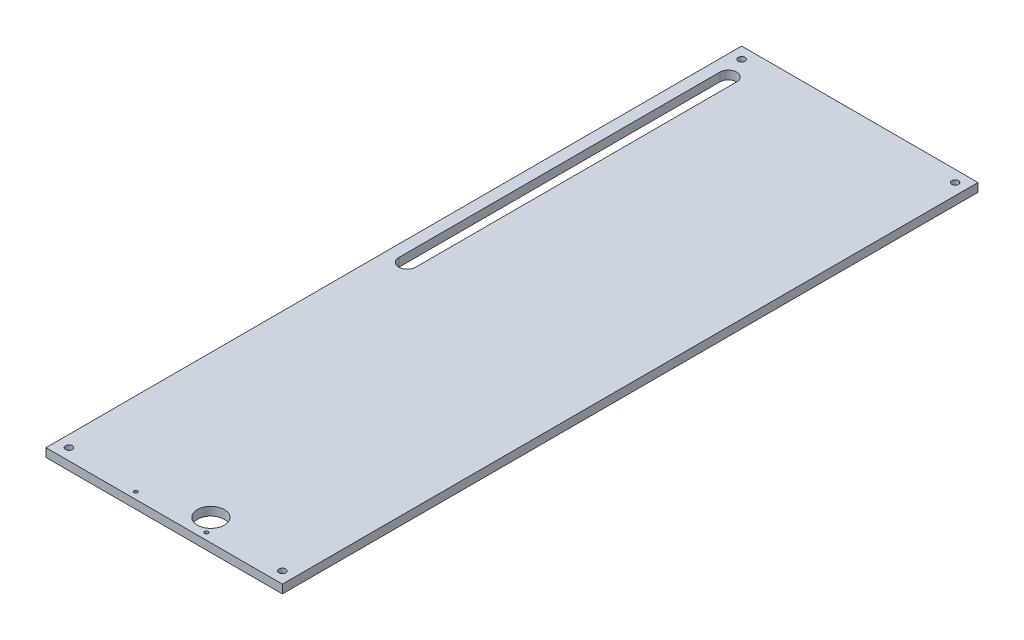
from build123d import *

# Parameters (mm, degrees)
SKETCH2_W           = 88.9
SKETCH2_H           = 3.2004
BOSS_EXTRUDE1_DEPTH = 261.62
SKETCH3_R           = 0.6731
SKETCH3_R_2         = 5.08
SKETCH3_R_3         = 1.27
CUT_EXTRUDE1_DEPTH  = 266.665663227


with BuildPart() as part:
    # Sketch2 → Boss-Extrude1 (new body)
    with BuildSketch(Plane.XY):
        with Locations((-1.625781684, -22.993244248)):
            Rectangle(SKETCH2_W, SKETCH2_H)
    extrude(amount=BOSS_EXTRUDE1_DEPTH)

    # Sketch3 → Cut-Extrude1 (cut, through all)
    with BuildSketch(Plane(origin=(0, -21.393044248, 0), x_dir=(-1, 0, 0), z_dir=(0, 1, 0))):
        with Locations((14.833781684, 259.08)):
            Circle(SKETCH3_R)
        with Locations((-11.683818316, 259.08)):
            Circle(SKETCH3_R)
        with Locations((-7.619818316, 253.318755316)):
            Circle(SKETCH3_R_2)
        with Locations((-38.506218316, 257.302)):
            Circle(SKETCH3_R_3)
        with Locations((41.757781684, 257.302)):
            Circle(SKETCH3_R_3)
        with Locations((-38.506218316, 4.318)):
            Circle(SKETCH3_R_3)
        with Locations((41.757781684, 4.318)):
            Circle(SKETCH3_R_3)
        with BuildLine():
            Line((35.32929924, 12.595958552), (35.32929924, 133.302587666))
            ThreePointArc((35.32929924, 133.302587666), (38.50429924, 136.477587666), (41.67929924, 133.302587666))
            Line((41.67929924, 133.302587666), (41.67929924, 12.595958552))
            ThreePointArc((41.67929924, 12.595958552), (38.50429924, 9.420958552), (35.32929924, 12.595958552))
        make_face()
    extrude(amount=-CUT_EXTRUDE1_DEPTH, mode=Mode.SUBTRACT)


solid = part.part
